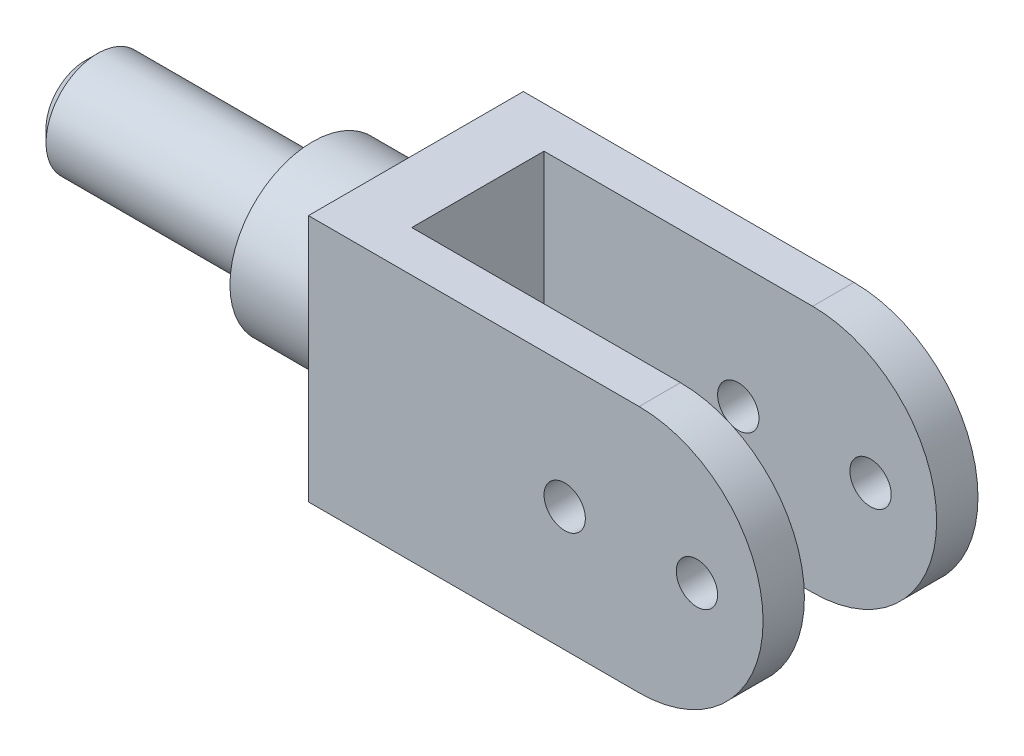
from build123d import *

# Parameters (mm, degrees)
BOSS_EXTRUDE2_DEPTH     = 60
CUT_EXTRUDE1_DEPTH      = 136.661343057
SKETCH3_R               = 12.5
BOSS_EXTRUDE3_DEPTH     = 80
SKETCH3_3_R             = 20
SKETCH3_3_R_2           = 12.5
BOSS_EXTRUDE4_DEPTH     = 25
FILLET2_R               = 6
CHAMFER1_SIZE           = 3
CUT_EXTRUDE2_DEPTH      = 136.661343057
CUT_EXTRUDE2_DEPTH_BACK = 136.661343057
SKETCH4_R               = 5


with BuildPart() as part:
    # Sketch1 → Boss-Extrude2 (new body)
    with BuildSketch(Plane(origin=(0, 0, 0), x_dir=(1, 0, 0), z_dir=(0, 1, 0))):
        Polygon((110, 10), (110, 0), (0, 0), (0, 52), (110, 52), (110, 42), (15, 42), (15, 10), align=None)
    extrude(amount=BOSS_EXTRUDE2_DEPTH)

    # Sketch2 → Cut-Extrude1 (cut, through all)
    with BuildSketch(Plane.XY):
        with BuildLine():
            Line((110, 60), (80, 60))
            ThreePointArc((80, 60), (101.213203436, 51.213203436), (110, 30))
            Line((110, 30), (110, 60))
        make_face()
        with BuildLine():
            Line((110, 0), (110, 30))
            ThreePointArc((110, 30), (101.213203436, 8.786796564), (80, 0))
            Line((80, 0), (110, 0))
        make_face()
    extrude(amount=-CUT_EXTRUDE1_DEPTH, mode=Mode.SUBTRACT)

    # Sketch3 → Boss-Extrude3 (add)
    with BuildSketch(Plane.ZY):
        with Locations((-26, 30)):
            Circle(SKETCH3_R)
    extrude(amount=BOSS_EXTRUDE3_DEPTH)

    # Sketch3<3> → Boss-Extrude4 (add)
    with BuildSketch(Plane.ZY):
        with Locations(Location((-26, 30, 0), (0, 0, 180))):
            Circle(SKETCH3_3_R)
        with Locations((-26, 30)):
            Circle(SKETCH3_3_R_2, mode=Mode.SUBTRACT)
    extrude(amount=BOSS_EXTRUDE4_DEPTH)

    # Fillet2
    fillet2_edges = [part.edges().sort_by_distance(p)[0] for p in [
        (0, 30, -6),
    ]]
    fillet(fillet2_edges, radius=FILLET2_R - 0.0001)  # a hair under: the kernel refuses the full size

    # Chamfer1
    chamfer1_edges = [part.edges().sort_by_distance(p)[0] for p in [
        (-80, 30, -38.5),
    ]]
    chamfer(chamfer1_edges, length=CHAMFER1_SIZE)

    # Sketch4 → Cut-Extrude2 (cut, two sides: drawn at the far end of the back side and taken through both)
    with BuildSketch(Plane.XY.offset(-CUT_EXTRUDE2_DEPTH_BACK)):
        with Locations((62, 30)):
            Circle(SKETCH4_R)
        with Locations((94, 30)):
            Circle(SKETCH4_R)
    extrude(amount=CUT_EXTRUDE2_DEPTH + CUT_EXTRUDE2_DEPTH_BACK, mode=Mode.SUBTRACT)


solid = part.part
